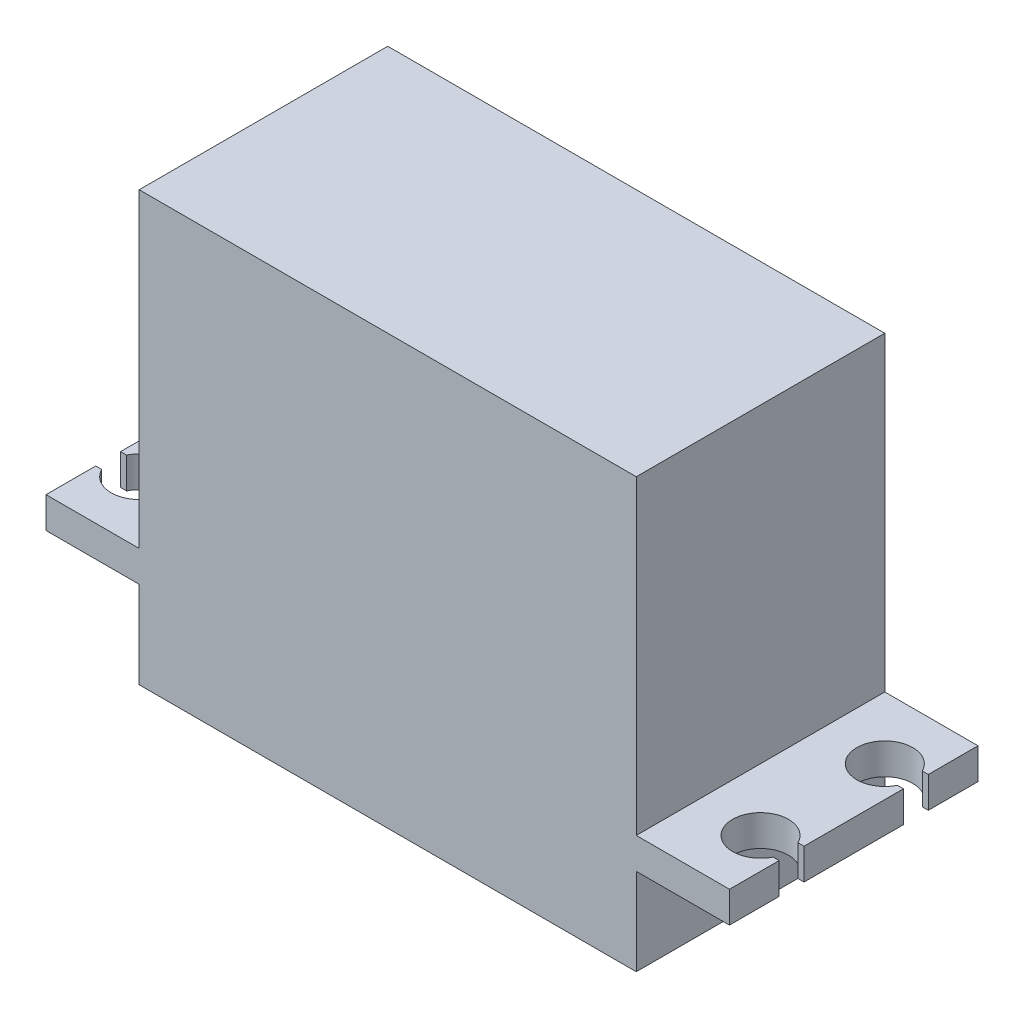
from build123d import *

# Parameters (mm, degrees)
BOSS_EXTRUDE1_DEPTH      = 25
BOSS_EXTRUDE1_DEPTH_BACK = 9.5
SKETCH1_W                = 40
SKETCH1_H                = 20
BOSS_EXTRUDE2_DEPTH      = 2.5
SKETCH3_R                = 3
BOSS_EXTRUDE3_DEPTH      = 6


with BuildPart() as part:
    # Sketch1 → Boss-Extrude1 (new, two sides: drawn at the far end of the back side and taken through both)
    with BuildSketch(Plane(origin=(0, 0, 0), x_dir=(1, 0, 0), z_dir=(0, 1, 0)).offset(-BOSS_EXTRUDE1_DEPTH_BACK)):
        with Locations((-20, 0)):
            Rectangle(SKETCH1_W, SKETCH1_H)
    extrude(amount=BOSS_EXTRUDE1_DEPTH + BOSS_EXTRUDE1_DEPTH_BACK)

    # Sketch2 → Boss-Extrude2 (add)
    with BuildSketch(Plane(origin=(0, 0, 0), x_dir=(1, 0, 0), z_dir=(0, 1, 0))):
        with BuildLine():
            Line((-40, 10), (-47.5, 10))
            Line((-47.5, 10), (-47.5, 6))
            Line((-47.5, 6), (-47.015564437, 6))
            ThreePointArc((-47.015564437, 6), (-42.75, 5), (-47.015564437, 4))
            Line((-47.015564437, 4), (-47.5, 4))
            Line((-47.5, 4), (-47.5, -4))
            Line((-47.5, -4), (-47.015564437, -4))
            ThreePointArc((-47.015564437, -4), (-42.75, -5), (-47.015564437, -6))
            Line((-47.015564437, -6), (-47.5, -6))
            Line((-47.5, -6), (-47.5, -10))
            Line((-47.5, -10), (-40, -10))
            Line((-40, -10), (-40, 10))
        make_face()
        with BuildLine():
            Line((7.5, -4), (7.5, 4))
            Line((7.5, 4), (7.015564437, 4))
            ThreePointArc((7.015564437, 4), (2.75, 5), (7.015564437, 6))
            Line((7.015564437, 6), (7.5, 6))
            Line((7.5, 6), (7.5, 10))
            Line((7.5, 10), (0, 10))
            Line((0, 10), (0, -10))
            Line((0, -10), (7.5, -10))
            Line((7.5, -10), (7.5, -6))
            Line((7.5, -6), (7.015564437, -6))
            ThreePointArc((7.015564437, -6), (2.75, -5), (7.015564437, -4))
            Line((7.015564437, -4), (7.5, -4))
        make_face()
    extrude(amount=-BOSS_EXTRUDE2_DEPTH)

    # Sketch3 → Boss-Extrude3 (add)
    with BuildSketch(Plane(origin=(0, -9.5, 0), x_dir=(-1, 0, 0), z_dir=(0, -1, 0))):
        with Locations((28.5, 0)):
            Circle(SKETCH3_R)
    extrude(amount=BOSS_EXTRUDE3_DEPTH)


solid = part.part
